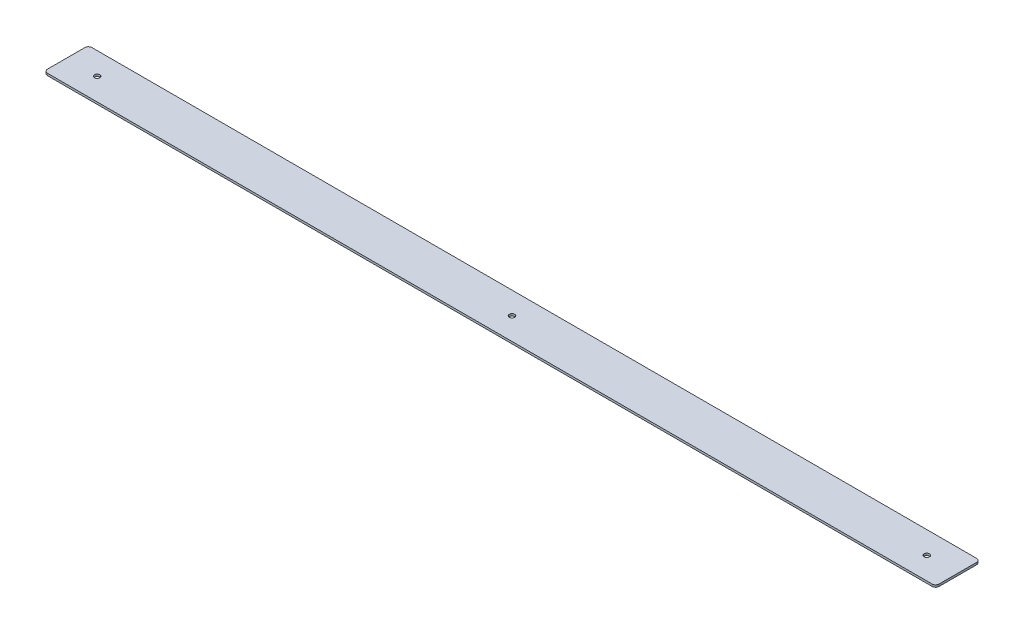
from build123d import *

# Parameters (mm, degrees)
SKETCH1_W           = 636.566333418
SKETCH1_H           = 31.75
BOSS_EXTRUDE1_DEPTH = 1.524
SKETCH2_R           = 1.905
CUT_EXTRUDE1_DEPTH  = 319.682463294
FILLET1_R           = 2.54


with BuildPart() as part:
    # Sketch1 → Boss-Extrude1 (new body)
    with BuildSketch(Plane(origin=(0, 0, 0), x_dir=(1, 0, 0), z_dir=(0, 1, 0))):
        Rectangle(SKETCH1_W, SKETCH1_H)
    extrude(amount=BOSS_EXTRUDE1_DEPTH)

    # Sketch2 → Cut-Extrude1 (cut, through all)
    with BuildSketch(Plane(origin=(0, 1.524, 0), x_dir=(1, 0, 0), z_dir=(0, 1, 0))):
        with Locations((-296.164, 0)):
            Circle(SKETCH2_R)
        with Locations((296.164, 0)):
            Circle(SKETCH2_R)
        Circle(SKETCH2_R)
    extrude(amount=-CUT_EXTRUDE1_DEPTH, mode=Mode.SUBTRACT)

    # Fillet1
    fillet1_edges = [part.edges().sort_by_distance(p)[0] for p in [
        (318.283166709, 0.762, 15.875),
        (318.283166709, 0.762, -15.875),
        (-318.283166709, 0.762, 15.875),
        (-318.283166709, 0.762, -15.875),
    ]]
    fillet(fillet1_edges, radius=FILLET1_R)


solid = part.part
